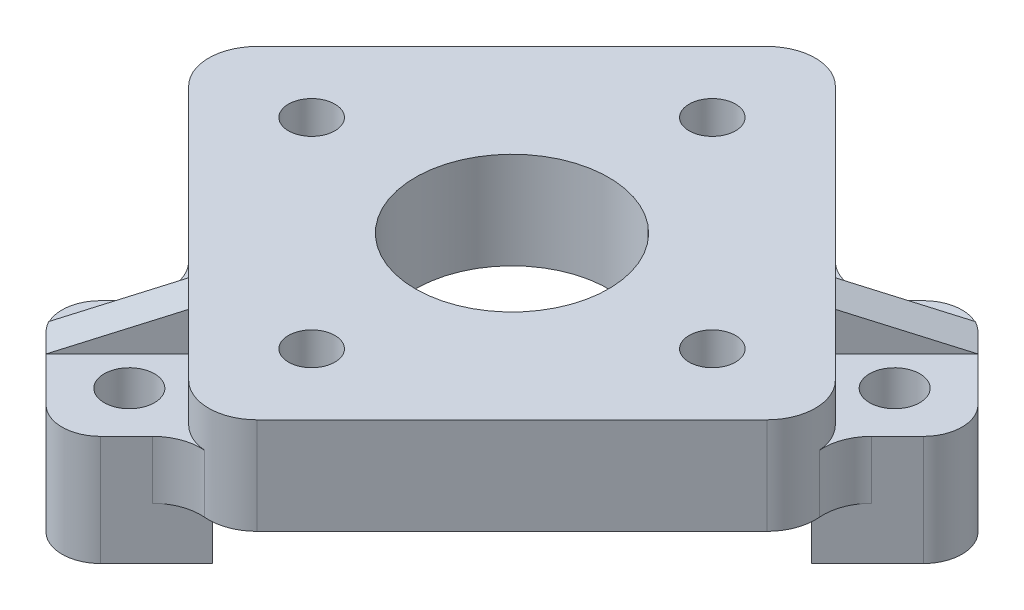
from build123d import *

# Parameters (mm, degrees)
SKETCH1_R                                       = 0.5
SKETCH1_R_2                                     = 5
BOSS_EXTRUDE1_DEPTH                             = 5
SKETCH3_R                                       = 1.3
BOSS_EXTRUDE4_DEPTH                             = 5.7
BOSS_EXTRUDE6_DEPTH                             = 1
FILLET1_R                                       = 2.5
FILLET2_R                                       = 2
CSK_FOR_M2_FLAT_HEAD_MACHINE_SCREW5_D           = 2.4
CSK_FOR_M2_FLAT_HEAD_MACHINE_SCREW5_DEPTH       = 42.93
CSK_FOR_M2_FLAT_HEAD_MACHINE_SCREW5_CSINK_D     = 4.4
CSK_FOR_M2_FLAT_HEAD_MACHINE_SCREW5_CSINK_ANGLE = 90
CSK_FOR_M2_FLAT_HEAD_MACHINE_SCREW5_TIP         = 0.721032743


with BuildPart() as part:
    # Sketch1 → Boss-Extrude1 (new body)
    with BuildSketch(Plane(origin=(0, 0, 0), x_dir=(1, 0, 0), z_dir=(0, 1, 0))):
        with BuildLine():
            Line((1.767766953, 14.961194078), (14.961194078, 1.767766953))
            ThreePointArc((14.961194078, 1.767766953), (15.693427125, 0), (14.961194078, -1.767766953))
            Line((14.961194078, -1.767766953), (1.767766953, -14.961194078))
            ThreePointArc((1.767766953, -14.961194078), (0, -15.693427125), (-1.767766953, -14.961194078))
            Line((-1.767766953, -14.961194078), (-14.961194078, -1.767766953))
            ThreePointArc((-14.961194078, -1.767766953), (-15.693427125, 0), (-14.961194078, 1.767766953))
            Line((-14.961194078, 1.767766953), (-1.767766953, 14.961194078))
            ThreePointArc((-1.767766953, 14.961194078), (0, 15.693427125), (1.767766953, 14.961194078))
        make_face()
        with Locations(Location((0, 10.365, 0), (0, 0, 270))):
            Circle(SKETCH1_R, mode=Mode.SUBTRACT)
        with Locations(Location((0, -10.365, 0), (0, 0, 270))):
            Circle(SKETCH1_R, mode=Mode.SUBTRACT)
        with Locations(Location((10.365, 0, 0), (0, 0, 270))):
            Circle(SKETCH1_R, mode=Mode.SUBTRACT)
        with Locations(Location((-10.365, 0, 0), (0, 0, 270))):
            Circle(SKETCH1_R, mode=Mode.SUBTRACT)
        with Locations(Location((0, 0, 0), (0, 0, 270))):
            Circle(SKETCH1_R_2, mode=Mode.SUBTRACT)
    extrude(amount=BOSS_EXTRUDE1_DEPTH)

    # Sketch3 → Boss-Extrude4 (add)
    # profile 1 of 4: a face of its own
    with BuildSketch(Plane(origin=(0, -2.7, 0), x_dir=(1, 0, 0), z_dir=(0, 1, 0))):
        Polygon((-4.949747468, -10.537489101), (-0.637994164, -14.849242405), (-4.949747468, -19.160995709), (-9.261500772, -14.849242405), align=None)
        with Locations(Location((-4.949747468, -14.849242405, 0), (0, 0, 90))):
            Circle(SKETCH3_R, mode=Mode.SUBTRACT)
    # profile 2 of 4: a face of its own
    with BuildSketch(Plane(origin=(0, -2.7, 0), x_dir=(1, 0, 0), z_dir=(0, 1, 0))):
        Polygon((-6.717514421, -8.769722148), (-11.029267725, -13.081475452), (-9.261500772, -14.849242405), (-4.949747468, -10.537489101), align=None)
    # profile 3 of 4: a face of its own
    with BuildSketch(Plane(origin=(0, -2.7, 0), x_dir=(1, 0, 0), z_dir=(0, 1, 0))):
        Polygon((19.160995709, 4.949747468), (14.849242405, 9.261500772), (10.537489101, 4.949747468), (14.849242405, 0.637994164), align=None)
        with Locations(Location((14.849242405, 4.949747468, 0), (0, 0, 90))):
            Circle(SKETCH3_R, mode=Mode.SUBTRACT)
    # profile 4 of 4: a face of its own
    with BuildSketch(Plane(origin=(0, -2.7, 0), x_dir=(1, 0, 0), z_dir=(0, 1, 0))):
        Polygon((13.081475452, 11.029267725), (14.849242405, 9.261500772), (10.537489101, 4.949747468), (8.769722148, 6.717514421), align=None)
    extrude(amount=BOSS_EXTRUDE4_DEPTH)


with BuildPart() as boss_extrude6_tool:
    # Sketch7 → Boss-Extrude6 (new, symmetric)
    with BuildSketch(Plane(origin=(2.707626069, -2.13e-07, 2.707626069), x_dir=(0.7071067811865474, 0, -0.7071067811865478), z_dir=(0.7071067811865467, -5.5755039757469385e-08, 0.7071067811865462))):
        Polygon((11.829161787, 5.00000052), (17.04887, 3.00000056), (11.829161787, 3.00000052), align=None)
        Polygon((-11.829161787, 5.00000052), (-17.04887, 3.00000056), (-11.829161787, 3.00000052), align=None)
    extrude(amount=BOSS_EXTRUDE6_DEPTH, both=True)


with BuildPart() as part_1:
    add(part.part)


with BuildPart() as part_2:
    # Boss-Extrude6: joined with boss_extrude6_tool
    add(part_1.part.fuse(boss_extrude6_tool.part, tol=0.00001))

    # Fillet1
    fillet1_edges = [part_2.edges().sort_by_distance(p)[0] for p in [
        (-7.338376652, 1.5, 9.390584379),
        (-1.184018869, 1.5, 15.395267109),
        (9.390584379, 1.5, -7.338376652),
        (15.395267109, 1.5, -1.184018869),
    ]]
    fillet(fillet1_edges, radius=FILLET1_R)

    # Fillet2
    # the kernel refuses this fillet: 2 mm, written as the material it takes off along each edge
    with BuildSketch(Plane(origin=(-4.949747468, -7.7, 19.160995709), x_dir=(-0.7071067811865471, 0, -0.707106781186548), z_dir=(0, 1, 0)), Plane(origin=(13.081475452, -7.7, -11.029267725), x_dir=(0.7071067811865476, 0, 0.7071067811865476), z_dir=(0, 1, 0))) as fillet2_piece_1:
        with BuildLine():
            CenterArc((FILLET2_R, -FILLET2_R), FILLET2_R, 90, 90)
            Line((0, -FILLET2_R), (0, 0))
            Line((0, 0), (FILLET2_R, 0))
        make_face()
    extrude(amount=15.7, mode=Mode.SUBTRACT)
    with BuildSketch(Plane(origin=(-11.029267725, -7.7, 13.081475452), x_dir=(0.707106781186547, 0, 0.7071067811865479), z_dir=(0, 1, 0)), Plane(origin=(19.160995709, -7.7, -4.949747468), x_dir=(-0.7071067811865482, 0, -0.7071067811865469), z_dir=(0, 1, 0))) as fillet2_piece_2:
        with BuildLine():
            CenterArc((FILLET2_R, FILLET2_R), FILLET2_R, 180, 90)
            Line((0, FILLET2_R), (0, 0))
            Line((0, 0), (FILLET2_R, 0))
        make_face()
    extrude(amount=15.7, mode=Mode.SUBTRACT)

    # CSK for M2 Flat Head Machine Screw5
    with Locations(Plane.XZ):
        with Locations((0, 10.365), (10.365, 0), (-10.365, 0), (0, -10.365)):
            CounterSinkHole(CSK_FOR_M2_FLAT_HEAD_MACHINE_SCREW5_D / 2, CSK_FOR_M2_FLAT_HEAD_MACHINE_SCREW5_CSINK_D / 2, depth=CSK_FOR_M2_FLAT_HEAD_MACHINE_SCREW5_DEPTH, counter_sink_angle=CSK_FOR_M2_FLAT_HEAD_MACHINE_SCREW5_CSINK_ANGLE)
            with Locations((0, 0, -(CSK_FOR_M2_FLAT_HEAD_MACHINE_SCREW5_DEPTH + CSK_FOR_M2_FLAT_HEAD_MACHINE_SCREW5_TIP / 2))):  # 118° drill point
                Cone(0, CSK_FOR_M2_FLAT_HEAD_MACHINE_SCREW5_D / 2, CSK_FOR_M2_FLAT_HEAD_MACHINE_SCREW5_TIP, mode=Mode.SUBTRACT)


solid = part_2.part
